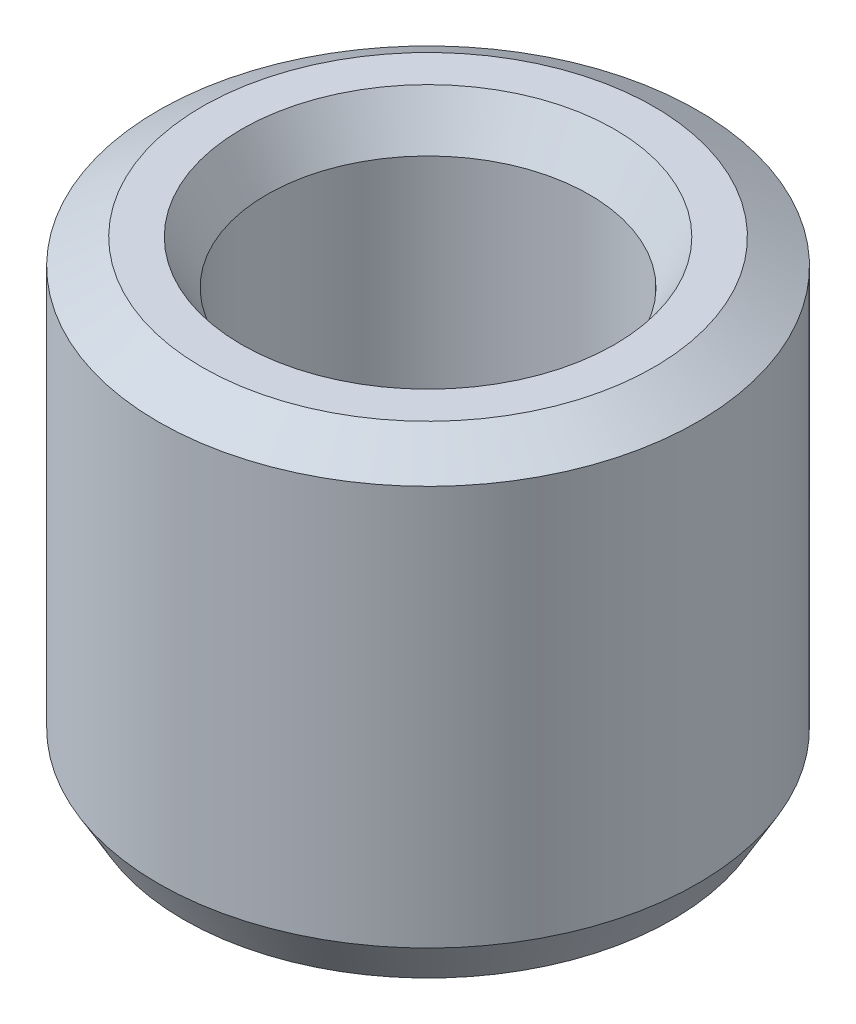
from build123d import *
from OCP.BRepFilletAPI import BRepFilletAPI_MakeChamfer

# Parameters (mm, degrees)
SKETCH1_R           = 30
BOSS_EXTRUDE1_DEPTH = 52.171537931
SKETCH2_R           = 17.928163025
CUT_EXTRUDE1_DEPTH  = 68.24484642
CHAMFER1_SIZE       = 2.817759897
CHAMFER1_SIZE2      = 4.880503306


with BuildPart() as part:
    # Sketch1 → Boss-Extrude1 (new body)
    with BuildSketch(Plane(origin=(0, 0, 0), x_dir=(1, 0, 0), z_dir=(0, 1, 0))):
        Circle(SKETCH1_R)
    extrude(amount=BOSS_EXTRUDE1_DEPTH)

    # Sketch2 → Cut-Extrude1 (cut, through all)
    with BuildSketch(Plane(origin=(0, 0, 0), x_dir=(1, 0, 0), z_dir=(0, 1, 0))):
        Circle(SKETCH2_R)
    extrude(amount=CUT_EXTRUDE1_DEPTH, mode=Mode.SUBTRACT)

    # Chamfer1: one chamfer whose edges measure the first distance from different faces: ONE call of the kernel's chamfer builder (chamfer() names one face for all edges)
    chamfer1_edges_1 = [part.edges().sort_by_distance(p)[0] for p in [
        (-17.928163025, 52.171537931, 0),
    ]]
    chamfer1_side_1 = [part.faces().sort_by_distance(p)[0] for p in [
        (-29.151471863, 52.171537931, 0),
    ]]
    chamfer1_edges_2 = [part.edges().sort_by_distance(p)[0] for p in [
        (-17.928163025, 0, 0),
    ]]
    chamfer1_side_2 = [part.faces().sort_by_distance(p)[0] for p in [
        (-17.928163025, 26.085768966, 0),
    ]]
    chamfer1_edges_3 = [part.edges().sort_by_distance(p)[0] for p in [
        (-30, 0, 0),
    ]]
    chamfer1_side_3 = [part.faces().sort_by_distance(p)[0] for p in [
        (-29.151471863, 0, 0),
    ]]
    chamfer1_edges_4 = [part.edges().sort_by_distance(p)[0] for p in [
        (-30, 52.171537931, 0),
    ]]
    chamfer1_side_4 = [part.faces().sort_by_distance(p)[0] for p in [
        (-30, 26.085768966, 0),
    ]]
    chamfer1 = BRepFilletAPI_MakeChamfer(part.part.solid().wrapped)
    for e in chamfer1_edges_1:
        chamfer1.Add(CHAMFER1_SIZE, CHAMFER1_SIZE2, e.wrapped, chamfer1_side_1[0].wrapped)  # the first distance lies on this face
    for e in chamfer1_edges_2:
        chamfer1.Add(CHAMFER1_SIZE, CHAMFER1_SIZE2, e.wrapped, chamfer1_side_2[0].wrapped)  # the first distance lies on this face
    for e in chamfer1_edges_3:
        chamfer1.Add(CHAMFER1_SIZE, CHAMFER1_SIZE2, e.wrapped, chamfer1_side_3[0].wrapped)  # the first distance lies on this face
    for e in chamfer1_edges_4:
        chamfer1.Add(CHAMFER1_SIZE, CHAMFER1_SIZE2, e.wrapped, chamfer1_side_4[0].wrapped)  # the first distance lies on this face
    add(Compound.cast(chamfer1.Shape()), mode=Mode.REPLACE)


solid = part.part
